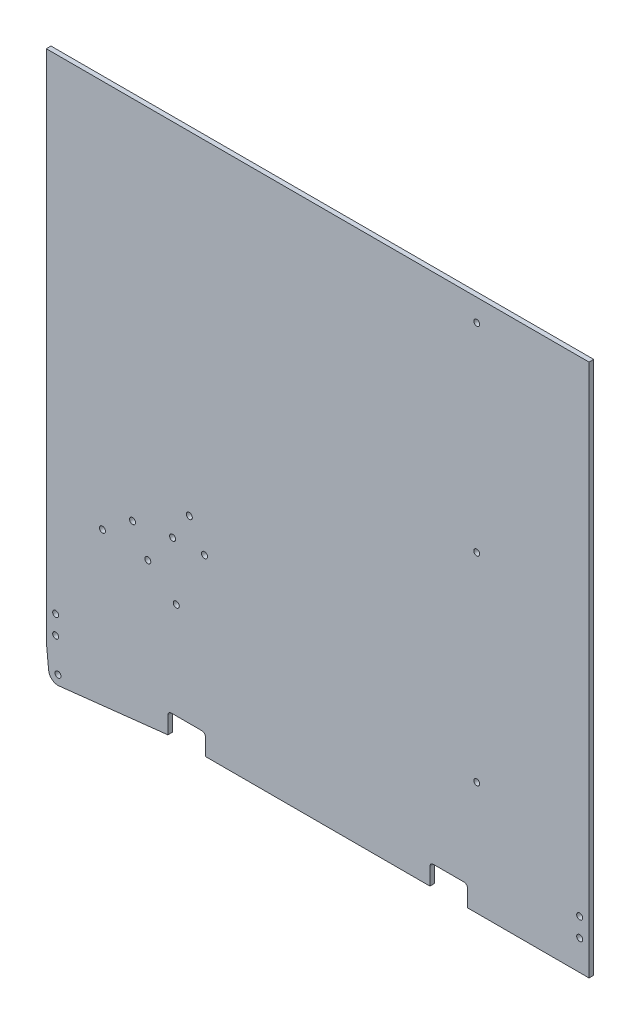
from build123d import *

# Parameters (mm, degrees)
SKETCH1_R           = 2.032
SKETCH1_R_2         = 2
BOSS_EXTRUDE1_DEPTH = 3.175
FILLET1_R           = 2.286


with BuildPart() as part:
    # Sketch1 → Boss-Extrude1 (new body)
    with BuildSketch(Plane.XY):
        with BuildLine():
            Line((82.55, -20.32), (82.55, -6.35))
            Line((82.55, -6.35), (107.95, -6.35))
            Line((107.95, -6.35), (107.95, -20.32))
            Line((107.95, -20.32), (260.35, -20.32))
            Line((260.35, -20.32), (260.35, -6.35))
            Line((260.35, -6.35), (285.75, -6.35))
            Line((285.75, -6.35), (285.75, -20.32))
            Line((285.75, -20.32), (368.3, -20.32))
            Line((368.3, -20.32), (368.3, 341.63))
            Line((368.3, 341.63), (0, 341.63))
            Line((0, 341.63), (0, 0))
            Line((0, 0), (0, -6.35))
            ThreePointArc((0, -6.35), (0.007883354, -6.666317007), (0.031513842, -6.981848616))
            Line((0.031513842, -6.981848616), (1.619013842, -22.856848616))
            ThreePointArc((1.619013842, -22.856848616), (3.943628298, -27.161748811), (8.639060666, -28.536126099))
            Line((8.639060666, -28.536126099), (82.55, -20.32))
        make_face()
        with Locations((6.35, 0)):
            Circle(SKETCH1_R, mode=Mode.SUBTRACT)
        with Locations((6.35, 12.7)):
            Circle(SKETCH1_R, mode=Mode.SUBTRACT)
        with Locations((361.95, 0)):
            Circle(SKETCH1_R, mode=Mode.SUBTRACT)
        with Locations((361.95, 12.7)):
            Circle(SKETCH1_R, mode=Mode.SUBTRACT)
        with Locations((7.9375, -22.225)):
            Circle(SKETCH1_R, mode=Mode.SUBTRACT)
        with Locations((38.1, 78.105)):
            Circle(SKETCH1_R, mode=Mode.SUBTRACT)
        with Locations((85.725, 97.155)):
            Circle(SKETCH1_R, mode=Mode.SUBTRACT)
        with Locations((58.568579744, 93.391299635)):
            Circle(SKETCH1_R, mode=Mode.SUBTRACT)
        with Locations((68.887329744, 75.518700365)):
            Circle(SKETCH1_R, mode=Mode.SUBTRACT)
        with Locations((107.382158942, 97.743700365)):
            Circle(SKETCH1_R, mode=Mode.SUBTRACT)
        with Locations((97.063408942, 115.616299635)):
            Circle(SKETCH1_R, mode=Mode.SUBTRACT)
        with Locations((88.216909404, 59.136578314)):
            Circle(SKETCH1_R, mode=Mode.SUBTRACT)
        with Locations((292.1, 56.63)):
            Circle(SKETCH1_R_2, mode=Mode.SUBTRACT)
        with Locations((292.1, 191.63)):
            Circle(SKETCH1_R_2, mode=Mode.SUBTRACT)
        with Locations((292.1, 326.63)):
            Circle(SKETCH1_R_2, mode=Mode.SUBTRACT)
    extrude(amount=BOSS_EXTRUDE1_DEPTH)

    # Fillet1
    fillet1_edges = [part.edges().sort_by_distance(p)[0] for p in [
        (285.75, -6.35, 1.5875),
        (107.95, -6.35, 1.5875),
        (260.35, -6.35, 1.5875),
        (82.55, -6.35, 1.5875),
    ]]
    fillet(fillet1_edges, radius=FILLET1_R)


solid = part.part
